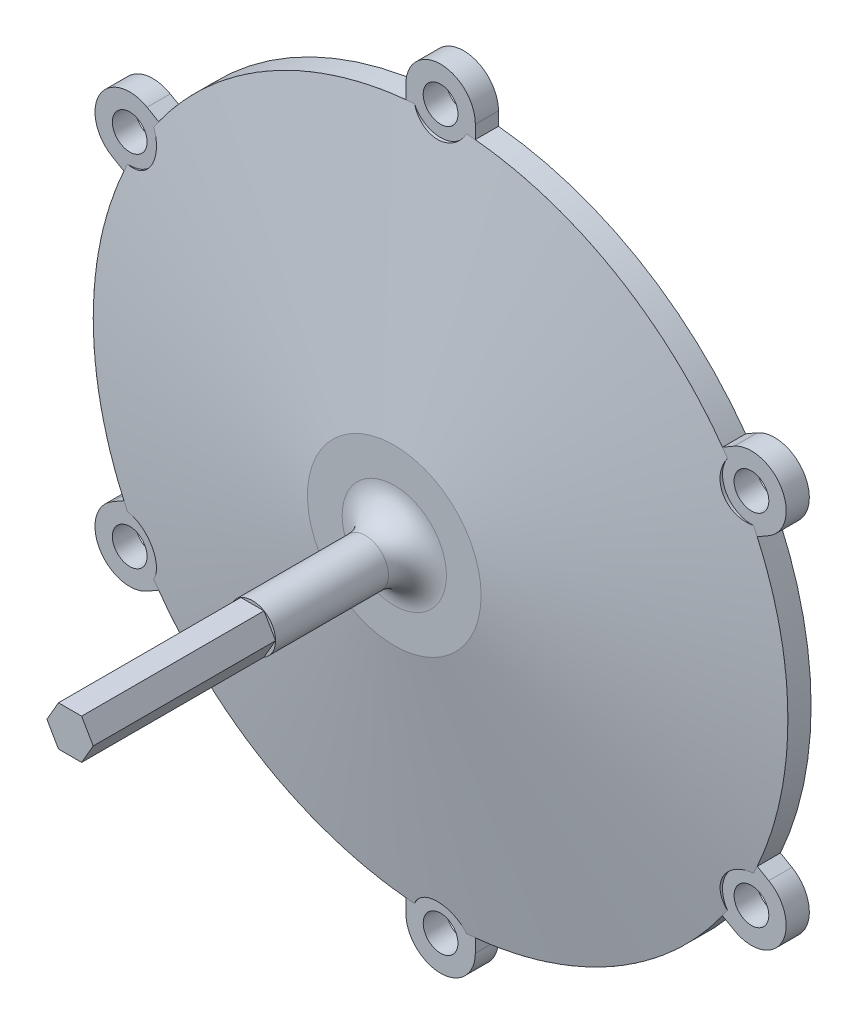
from build123d import *

# Parameters (mm, degrees)
SKETCH1_R           = 57
BOSS_EXTRUDE1_DEPTH = 4
SKETCH4_R           = 14
CUT_EXTRUDE1_DEPTH  = 7
SKETCH9_R           = 11.5
CUT_EXTRUDE4_DEPTH  = 0.5
SKETCH10_R          = 4
BOSS_EXTRUDE2_DEPTH = 56
FILLET1_R           = 5
SKETCH7_R           = 3
CUT_EXTRUDE2_DEPTH  = 111.995495404
SKETCH8_R           = 5
CUT_EXTRUDE3_DEPTH  = 111.995495404
CIRPATTERN6_COUNT   = 6
CUT_EXTRUDE5_DEPTH  = 31.5


with BuildPart() as part:
    # Sketch1 → Boss-Extrude1 (new body)
    with BuildSketch(Plane.XY):
        with BuildLine():
            ThreePointArc((6, 62), (0, 68), (-6, 62))
            Line((-6, 62), (-6, 59.699246226))
            ThreePointArc((-6, 59.699246226), (-30, 51.961524227), (-48.701063819, 35.045775536))
            Line((-48.701063819, 35.045775536), (-50.693575035, 36.196152423))
            ThreePointArc((-50.693575035, 36.196152423), (-58.889727457, 34), (-56.693575035, 25.803847577))
            Line((-56.693575035, 25.803847577), (-54.701063819, 24.65347069))
            ThreePointArc((-54.701063819, 24.65347069), (-60, 0), (-54.701063819, -24.65347069))
            Line((-54.701063819, -24.65347069), (-56.693575035, -25.803847577))
            ThreePointArc((-56.693575035, -25.803847577), (-58.889727457, -34), (-50.693575035, -36.196152423))
            Line((-50.693575035, -36.196152423), (-48.701063819, -35.045775536))
            ThreePointArc((-48.701063819, -35.045775536), (-30, -51.961524227), (-6, -59.699246226))
            Line((-6, -59.699246226), (-6, -62))
            ThreePointArc((-6, -62), (0, -68), (6, -62))
            Line((6, -62), (6, -59.699246226))
            ThreePointArc((6, -59.699246226), (30, -51.961524227), (48.701063819, -35.045775536))
            Line((48.701063819, -35.045775536), (50.693575035, -36.196152423))
            ThreePointArc((50.693575035, -36.196152423), (58.889727457, -34), (56.693575035, -25.803847577))
            Line((56.693575035, -25.803847577), (54.701063819, -24.65347069))
            ThreePointArc((54.701063819, -24.65347069), (60, 0), (54.701063819, 24.65347069))
            Line((54.701063819, 24.65347069), (56.693575035, 25.803847577))
            ThreePointArc((56.693575035, 25.803847577), (58.889727457, 34), (50.693575035, 36.196152423))
            Line((50.693575035, 36.196152423), (48.701063819, 35.045775536))
            ThreePointArc((48.701063819, 35.045775536), (30, 51.961524227), (6, 59.699246226))
            Line((6, 59.699246226), (6, 62))
        make_face()
        Circle(SKETCH1_R, mode=Mode.SUBTRACT)
    extrude(amount=BOSS_EXTRUDE1_DEPTH)

    # Sketch7 → Cut-Extrude2 (cut, through all)
    with BuildSketch(Plane.XY.offset(4)):
        with Locations((0, 62)):
            Circle(SKETCH7_R)
    cut_extrude2 = extrude(amount=-CUT_EXTRUDE2_DEPTH, mode=Mode.SUBTRACT)


with BuildPart() as body_2:
    # Sketch3 → Revolve1 (revolve)
    with BuildSketch(Plane(origin=(0, 0, 0), x_dir=(1, 0, 0), z_dir=(0, 1, 0))):
        Polygon((0, -0.5), (0, -12), (15, -12), (60, -4), (57, -4), (57, -0.5), align=None)
    revolve(axis=Axis((0, 0, 12), (0, 0, -1)))

    # Sketch4 → Cut-Extrude1 (cut)
    with BuildSketch(Plane.XY.offset(0.5)):
        Circle(SKETCH4_R)
    extrude(amount=CUT_EXTRUDE1_DEPTH, mode=Mode.SUBTRACT)

    # Sketch9 → Cut-Extrude4 (cut)
    with BuildSketch(Plane(origin=(0, 0, 7.5), x_dir=(-1, 0, 0), z_dir=(0, 0, -1))):
        Circle(SKETCH9_R)
    extrude(amount=-CUT_EXTRUDE4_DEPTH, mode=Mode.SUBTRACT)

    # Sketch10 → Boss-Extrude2 (add)
    with BuildSketch(Plane.XY.offset(12)):
        Circle(SKETCH10_R)
    extrude(amount=BOSS_EXTRUDE2_DEPTH)

    # Fillet1
    fillet1_edges = [body_2.edges().sort_by_distance(p)[0] for p in [
        (-4, 0, 12),
    ]]
    fillet(fillet1_edges, radius=FILLET1_R)

    # Sketch8 → Cut-Extrude3 (cut, through all)
    with BuildSketch(Plane.XY.offset(4)):
        with Locations((0, 62)):
            Circle(SKETCH8_R)
    cut_extrude3 = extrude(amount=CUT_EXTRUDE3_DEPTH, mode=Mode.SUBTRACT)


with BuildPart() as cirpattern6_tool:
    # CirPattern6: Cut-Extrude2, Cut-Extrude3 ×6 about axis
    cirpattern6_axis = Axis((0, 0, 4), (0, 0, 1))
    add([cut_extrude2.rotate(cirpattern6_axis, i * 360 / CIRPATTERN6_COUNT) for i in range(1, CIRPATTERN6_COUNT)])
    add([cut_extrude3.rotate(cirpattern6_axis, i * 360 / CIRPATTERN6_COUNT) for i in range(1, CIRPATTERN6_COUNT)])


with BuildPart() as part_1:
    add(part.part)

    # CirPattern6: cut by cirpattern6_tool
    add(cirpattern6_tool.part, mode=Mode.SUBTRACT)


with BuildPart() as body_2_1:
    add(body_2.part)

    # CirPattern6: cut by cirpattern6_tool
    add(cirpattern6_tool.part, mode=Mode.SUBTRACT)

    # Sketch11 → Cut-Extrude5 (cut)
    with BuildSketch(Plane.XY.offset(68)):
        with BuildLine():
            ThreePointArc((4, 0), (3.464101615, 2), (2, 3.464101615))
            Line((2, 3.464101615), (4, 0))
        make_face()
        with BuildLine():
            Line((-2, 3.464101615), (2, 3.464101615))
            ThreePointArc((2, 3.464101615), (0, 4), (-2, 3.464101615))
        make_face()
        with BuildLine():
            Line((-4, 0), (-2, 3.464101615))
            ThreePointArc((-2, 3.464101615), (-3.464101615, 2), (-4, 0))
        make_face()
        with BuildLine():
            ThreePointArc((2, -3.464101615), (3.464101615, -2), (4, 0))
            Line((4, 0), (2, -3.464101615))
        make_face()
        with BuildLine():
            Line((-2, -3.464101615), (-4, 0))
            ThreePointArc((-4, 0), (-3.464101615, -2), (-2, -3.464101615))
        make_face()
        with BuildLine():
            ThreePointArc((-2, -3.464101615), (0, -4), (2, -3.464101615))
            Line((2, -3.464101615), (-2, -3.464101615))
        make_face()
    extrude(amount=-CUT_EXTRUDE5_DEPTH, mode=Mode.SUBTRACT)


solid = Compound([part_1.part, body_2_1.part])
